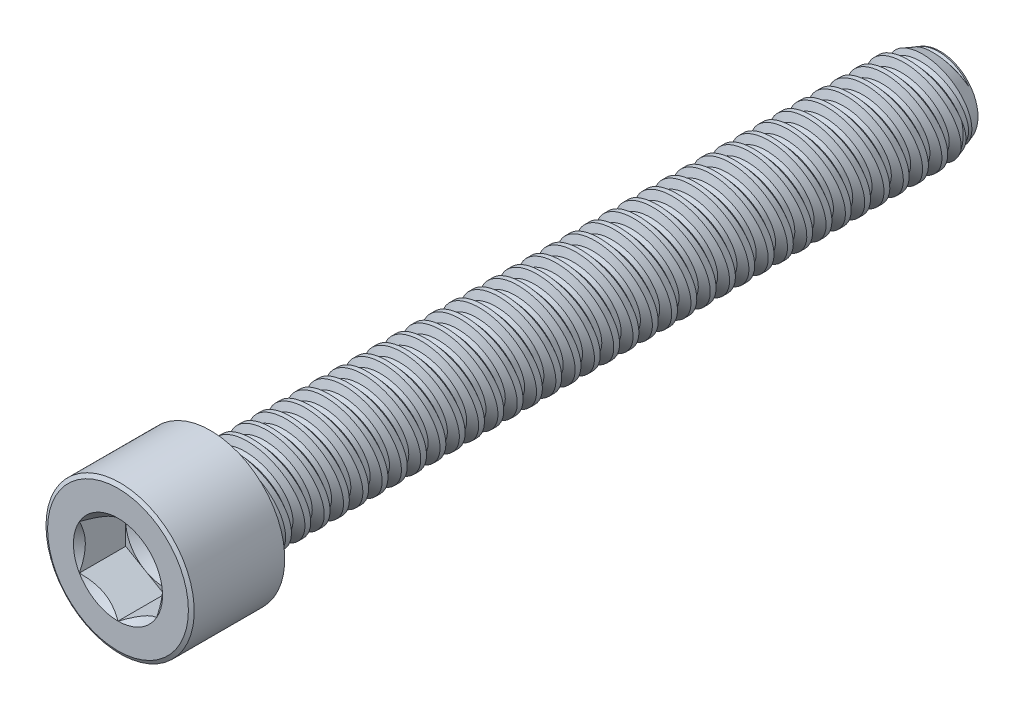
from build123d import *

# Parameters (mm, degrees)
SKETCH1_W          = 12
SKETCH1_H          = 0.762
LPATTERN1_COUNT    = 38
LPATTERN1_PITCH    = 0.3175
LPATTERN2_COUNT    = 2
LPATTERN2_PITCH    = 0.3175
SKETCH4_R          = 1.2192
EXTRUDE1_DEPTH     = 1.524
CHAMFER1_SIZE      = 0.06096
CHAMFER1_SIZE2     = 0.035195272
CUT_EXTRUDE1_DEPTH = 0.762
SKETCH8_R          = 0.635
CUT_EXTRUDE5_DEPTH = 0.254
CUT_EXTRUDE5_DRAFT = -60


with BuildPart() as part:
    # Sketch1 → Revolve1 (revolve)
    with BuildSketch(Plane(origin=(0, 0, 0), x_dir=(0, 0, -1), z_dir=(1, 0, 0))):
        with Locations((6, 0.381)):
            Rectangle(SKETCH1_W, SKETCH1_H)
    revolve(axis=Axis((0, 0, 0), (0, 0, 1)))

    # Sketch2 → Cut-Revolve1 (revolve, cut)
    with BuildSketch(Plane(origin=(0, 0, 0), x_dir=(0, 0, -1), z_dir=(1, 0, 0))):
        Polygon((0.038853285, 0.770094434), (0.310826283, 0.826755476), (0.248742999, 0.638279729), (0.171036428, 0.62209086), align=None)
    cut_revolve1 = revolve(axis=Axis((0, -0.071078816, 0), (0, 0.2039542541120012, -0.978980419737605)), mode=Mode.SUBTRACT)

    # Sketch3 → Cut-Revolve2 (revolve, cut)
    with BuildSketch(Plane(origin=(0, 0, 0), x_dir=(0, 0, -1), z_dir=(1, 0, 0))):
        Polygon((12, 0.62209086), (11.615602796, 0.762), (12, 0.762), align=None)
    revolve(axis=Axis((0, 0, -11.615602796), (0, 0, 1)), mode=Mode.SUBTRACT)

    # LPattern1: Cut-Revolve1 ×38
    with Locations(*[(0, 0, -i * LPATTERN1_PITCH) for i in range(1, LPATTERN1_COUNT)]):
        add(cut_revolve1, mode=Mode.SUBTRACT)

    # LPattern2: Cut-Revolve1 ×2
    with Locations(*[(0, 0, i * LPATTERN2_PITCH) for i in range(1, LPATTERN2_COUNT)]):
        add(cut_revolve1, mode=Mode.SUBTRACT)

    # Sketch4 → Extrude1 (add)
    with BuildSketch(Plane.XY):
        Circle(SKETCH4_R)
    extrude(amount=EXTRUDE1_DEPTH)

    # Chamfer1
    chamfer1_edges = [part.edges().sort_by_distance(p)[0] for p in [
        (-1.2192, 0, 1.524),
    ]]
    chamfer1_side = [part.faces().sort_by_distance(p)[0] for p in [
        (0, 0, 1.524),
    ]]
    chamfer(chamfer1_edges, length=CHAMFER1_SIZE, length2=CHAMFER1_SIZE2, reference=chamfer1_side[0])

    # Sketch6 → Cut-Extrude1 (cut)
    with BuildSketch(Plane.XY.offset(1.524)):
        Polygon((0, -0.733234842), (0.635, -0.366617421), (0.635, 0.366617421), (0, 0.733234842), (-0.635, 0.366617421), (-0.635, -0.366617421), align=None)
    extrude(amount=-CUT_EXTRUDE1_DEPTH, mode=Mode.SUBTRACT)

    # Cut-Extrude4 cone 1 section (through the dimple's axis) → Cut-Extrude4 (revolve, cut)
    with BuildSketch(Plane(origin=(0, 0, 1.524), x_dir=(0, -1, 0), z_dir=(1, 0, 0))):
        Polygon((0, 0), (0.733234842, 0), (0, 0.733234842), align=None)
    revolve(axis=Axis((0, 0, 1.524), (0, 0, -1)), mode=Mode.SUBTRACT)


with BuildPart() as cut_extrude5_tool:
    # Sketch8 → Cut-Extrude5 (with draft: the straight prism first)
    with BuildSketch(Plane.XY.offset(0.762)):
        Circle(SKETCH8_R)
    extrude(amount=-CUT_EXTRUDE5_DEPTH)
    # Cut-Extrude5: the draft: its side faces are tilted about the plane it starts from
    cut_extrude5_sides = [cut_extrude5_tool.faces().sort_by_distance(p)[0] for p in [
        (-0.635, 0, 0.635),
    ]]
    draft(cut_extrude5_sides, Plane.XY.offset(0.762), CUT_EXTRUDE5_DRAFT)


with BuildPart() as part_1:
    add(part.part)

    # Cut-Extrude5: cut by cut_extrude5_tool
    add(cut_extrude5_tool.part, mode=Mode.SUBTRACT)


solid = part_1.part
